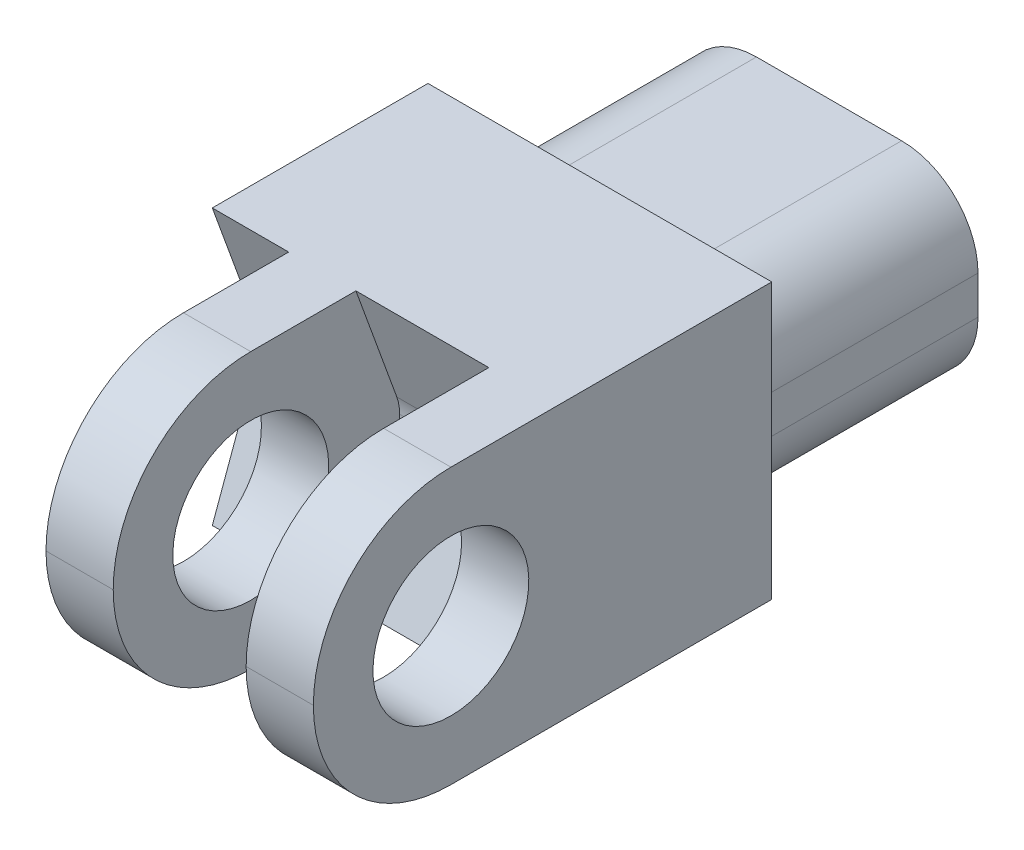
from build123d import *

# Parameters (mm, degrees)
SKETCH2_W           = 24.765
SKETCH2_H           = 15.875
BOSS_EXTRUDE1_DEPTH = 19.05
SKETCH3_W           = 28.575
SKETCH3_H           = 22.86
BOSS_EXTRUDE2_DEPTH = 38.1
SKETCH4_W           = 6.35
SKETCH4_H           = 23.8125
SKETCH4_W_2         = 11.049
CUT_EXTRUDE1_DEPTH  = 47.6725
FILLET5_R           = 11.43
SKETCH7_R           = 6.477
CUT_EXTRUDE3_DEPTH  = 46.56539833
FILLET3_R           = 6.35
BOSS_EXTRU_1_REACH  = 50.977
CONG_3_R            = 4


with BuildPart() as part:
    # Sketch2 → Boss-Extrude1 (new body)
    with BuildSketch(Plane.XY):
        Rectangle(SKETCH2_W, SKETCH2_H)
    extrude(amount=-BOSS_EXTRUDE1_DEPTH)

    # Sketch3 → Boss-Extrude2 (add)
    with BuildSketch(Plane.XY):
        Rectangle(SKETCH3_W, SKETCH3_H)
    extrude(amount=BOSS_EXTRUDE2_DEPTH)

    # Sketch4 → Cut-Extrude1 (cut, through all)
    with BuildSketch(Plane(origin=(0, -11.43, 0), x_dir=(-1, 0, 0), z_dir=(0, -1, 0))):
        with Locations((11.1125, -26.19375)):
            Rectangle(SKETCH4_W, SKETCH4_H)
        with Locations((-3.175, -26.19375)):
            Rectangle(SKETCH4_W_2, SKETCH4_H)
    extrude(amount=-CUT_EXTRUDE1_DEPTH, mode=Mode.SUBTRACT)

    # Fillet5
    fillet5_edges = [part.edges().sort_by_distance(p)[0] for p in [
        (-5.1435, -11.43, 38.1),
        (-5.1435, 11.43, 38.1),
        (11.4935, 11.43, 38.1),
        (11.4935, -11.43, 38.1),
    ]]
    fillet(fillet5_edges, radius=FILLET5_R - 0.0001)  # a hair under: the kernel refuses the full size

    # Sketch7 → Cut-Extrude3 (cut, through all)
    with BuildSketch(Plane.ZY.offset(7.9375)):
        with Locations(Location((26.67, 0, 0), (0, 0, 270))):
            Circle(SKETCH7_R)
    extrude(amount=-CUT_EXTRUDE3_DEPTH, mode=Mode.SUBTRACT)

    # Fillet3
    fillet3_edges = [part.edges().sort_by_distance(p)[0] for p in [
        (-12.3825, 7.9375, -9.525),
        (12.3825, 7.9375, -9.525),
        (12.3825, -7.9375, -9.525),
        (-12.3825, -7.9375, -9.525),
    ]]
    fillet(fillet3_edges, radius=FILLET3_R)

    # Boss.-Extru.1: up to this face of the body (flat: up to its plane)
    boss_extru_1_end = Plane(part.part.faces().sort_by_distance((14.2875, 0, 16.22567269))[0])
    # Esquisse1 → Boss.-Extru.1 (add, up to the picked face)
    with BuildSketch(Plane.ZY.offset(14.2875), mode=Mode.PRIVATE) as boss_extru_1_sk1:
        Polygon((14.2875, 11.43), (17.927202343, 11.43), (14.2875, 1.43), align=None)
    boss_extru_1_tool1 = split(extrude(boss_extru_1_sk1.sketch, amount=-BOSS_EXTRU_1_REACH, mode=Mode.PRIVATE), bisect_by=boss_extru_1_end, keep=Keep.BOTH, mode=Mode.PRIVATE)
    boss_extru_1 = boss_extru_1_tool1.solids().sort_by(Axis((-14.2875, 8.096667, 15.500734), (1, 0, 0)))[0]
    add(boss_extru_1)

    # Symétrie1: Boss.-Extru.1 across plane
    add(boss_extru_1.mirror(Plane.ZX))

    # Congé3
    cong_3_edges = [part.edges().sort_by_distance(p)[0] for p in [
        (-11.1125, 1.43, 14.2875),
        (3.175, 1.43, 14.2875),
        (-11.1125, -1.43, 14.2875),
        (3.175, -1.43, 14.2875),
    ]]
    fillet(cong_3_edges, radius=CONG_3_R)


solid = part.part
